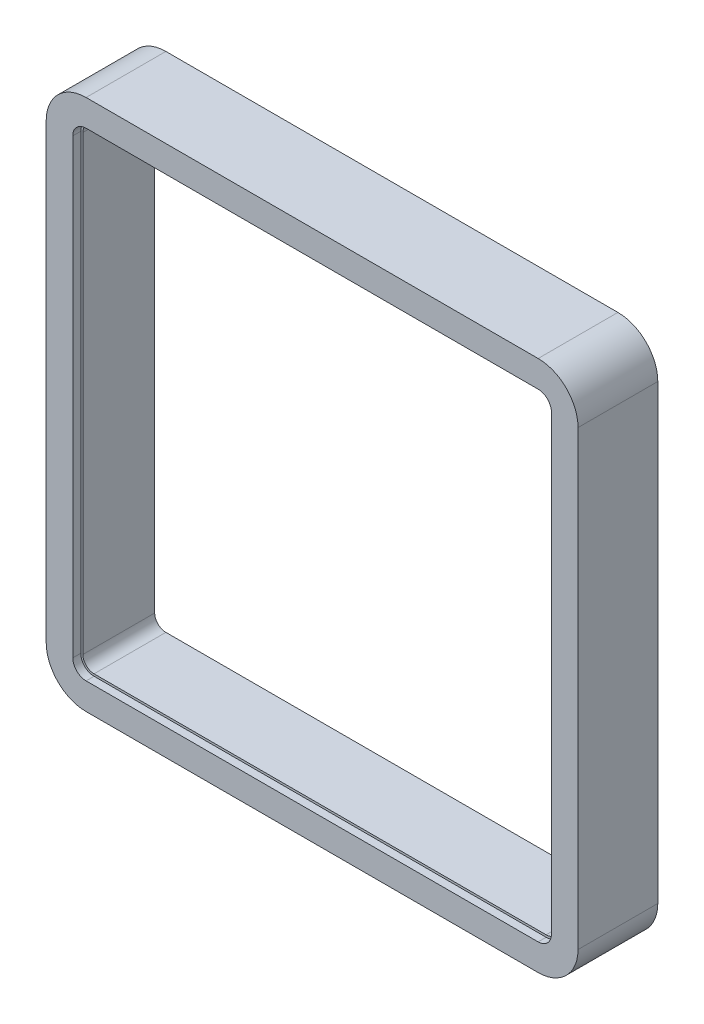
from build123d import *

# Parameters (mm, degrees)
SKETCH1_W           = 200
SKETCH1_H           = 200
BOSS_EXTRUDE1_DEPTH = 30
FILLET1_R           = 15
CUT_EXTRUDE2_DEPTH  = 3
CUT_EXTRUDE3_DEPTH  = 144.975692393


with BuildPart() as part:
    # Sketch1 → Boss-Extrude1 (new body)
    with BuildSketch(Plane.XY):
        Rectangle(SKETCH1_W, SKETCH1_H)
    extrude(amount=BOSS_EXTRUDE1_DEPTH)

    # Fillet1
    fillet1_edges = [part.edges().sort_by_distance(p)[0] for p in [
        (100, -100, 15),
        (-100, -100, 15),
        (100, 100, 15),
        (-100, 100, 15),
    ]]
    fillet(fillet1_edges, radius=FILLET1_R)

    # Sketch2 → Cut-Extrude2 (cut)
    with BuildSketch(Plane.XY.offset(30)):
        with BuildLine():
            Line((-85, -90), (85, -90))
            ThreePointArc((85, -90), (88.535533906, -88.535533906), (90, -85))
            Line((90, -85), (90, 85))
            ThreePointArc((90, 85), (88.535533906, 88.535533906), (85, 90))
            Line((85, 90), (-85, 90))
            ThreePointArc((-85, 90), (-88.535533906, 88.535533906), (-90, 85))
            Line((-90, 85), (-90, -85))
            ThreePointArc((-90, -85), (-88.535533906, -88.535533906), (-85, -90))
        make_face()
    extrude(amount=-CUT_EXTRUDE2_DEPTH, mode=Mode.SUBTRACT)

    # Sketch3 → Cut-Extrude3 (cut, through all)
    with BuildSketch(Plane.XY.offset(27)):
        with BuildLine():
            Line((-85, -89.2), (85, -89.2))
            ThreePointArc((85, -89.2), (87.969848481, -87.969848481), (89.2, -85))
            Line((89.2, -85), (89.2, 85))
            ThreePointArc((89.2, 85), (87.969848481, 87.969848481), (85, 89.2))
            Line((85, 89.2), (-85, 89.2))
            ThreePointArc((-85, 89.2), (-87.969848481, 87.969848481), (-89.2, 85))
            Line((-89.2, 85), (-89.2, -85))
            ThreePointArc((-89.2, -85), (-87.969848481, -87.969848481), (-85, -89.2))
        make_face()
    extrude(amount=-CUT_EXTRUDE3_DEPTH, mode=Mode.SUBTRACT)


solid = part.part
